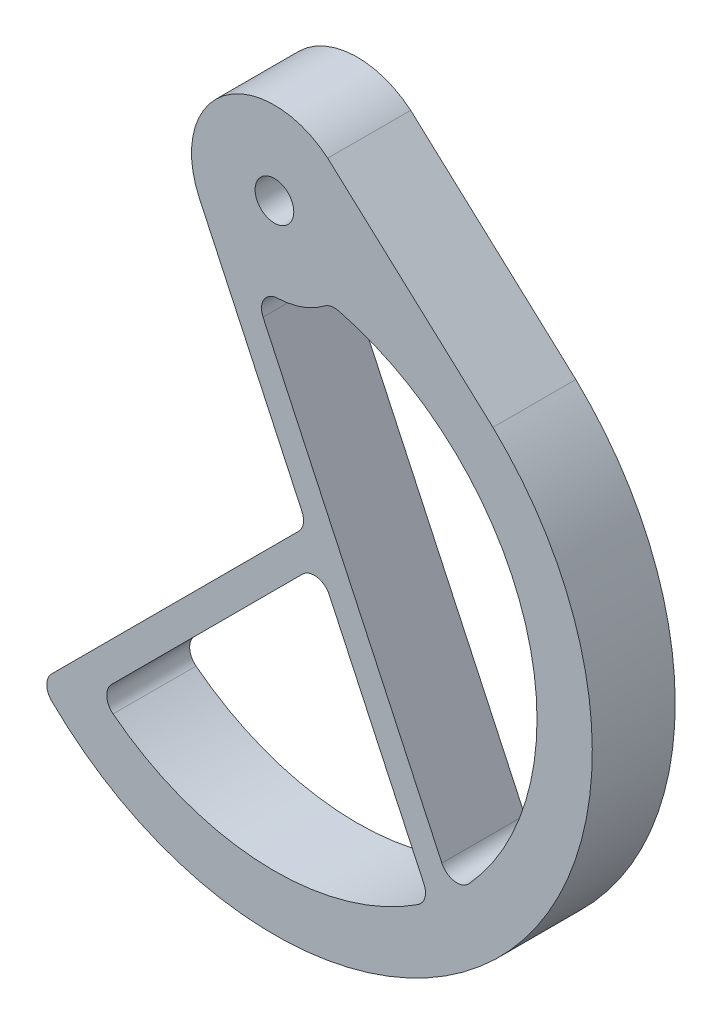
from build123d import *

# Parameters (mm, degrees)
EXTRUDE_1_DEPTH     = 15
SKETCH_6_R          = 3.5
CUT_EXTRUDE_2_DEPTH = 15
SKETCH_8_R          = 10.1
CUT_EXTRUDE_4_DEPTH = 2
SKETCH_9_R          = 0.5
CUT_EXTRUDE_5_DEPTH = 3


with BuildPart() as part:
    # ｽｹｯﾁ1 → ﾎﾞｽ - 押し出し1 (new body)
    with BuildSketch(Plane.XY):
        with BuildLine():
            Line((10.546944731, 68.165925034), (9.641814145, 68.990666647))
            ThreePointArc((9.641814145, 68.990666647), (-9.131421435, 69.400300104), (-13.594616806, 51.160726074))
            Line((-13.594616806, 51.160726074), (4.986432096, 11.313538113))
            ThreePointArc((4.986432096, 11.313538113), (5.221931994, 9.524738795), (4.388829079, 7.924362985))
            Line((4.388829079, 7.924362985), (-40.303464689, -36.767930783))
            ThreePointArc((-40.303464689, -36.767930783), (-41.182112782, -38.903012739), (-40.283913759, -41.029943849))
            ThreePointArc((-40.283913759, -41.029943849), (41.397896806, -39.905690573), (39.524106652, 41.762363359))
            Line((39.524106652, 41.762363359), (37.916838192, 43.226882625))
            Line((37.916838192, 43.226882625), (10.546944731, 68.165925034))
        make_face()
        with BuildLine():
            ThreePointArc((5.093338956, 1.55780505), (7.735603832, 2.390907965), (9.933582661, 0.704339492))
            Line((9.933582661, 0.704339492), (27.046217634, -35.993824637))
            ThreePointArc((27.046217634, -35.993824637), (27.212084573, -38.085077821), (25.967336583, -39.773702754))
            ThreePointArc((25.967336583, -39.773702754), (-1.972837213, -47.459012983), (-29.17877254, -37.481318454))
            ThreePointArc((-29.17877254, -37.481318454), (-30.330146685, -35.299826939), (-29.457223039, -32.992756945))
            Line((-29.457223039, -32.992756945), (5.093338956, 1.55780505))
        make_face(mode=Mode.SUBTRACT)
        with BuildLine():
            ThreePointArc((35.231836325, -31.858557864), (32.560090836, -32.813013733), (30.287744354, -31.114293205))
            Line((30.287744354, -31.114293205), (-2.054746852, 38.244403012))
            ThreePointArc((-2.054746852, 38.244403012), (-1.895310582, 41.077194163), (0.553480425, 42.510214831))
            ThreePointArc((0.553480425, 42.510214831), (5.039223996, 43.371793408), (9.057681155, 45.543478261))
            ThreePointArc((9.057681155, 45.543478261), (10.270904088, 46.091905397), (11.601973614, 46.061309233))
            ThreePointArc((11.601973614, 46.061309233), (45.455779175, 13.784851815), (35.231836325, -31.858557864))
        make_face(mode=Mode.SUBTRACT)
    extrude(amount=EXTRUDE_1_DEPTH)

    # ｽｹｯﾁ6 → ｶｯﾄ - 押し出し2 (cut)
    with BuildSketch(Plane.XY.offset(15)):
        with Locations((0, 57.5)):
            Circle(SKETCH_6_R)
    extrude(amount=-CUT_EXTRUDE_2_DEPTH, mode=Mode.SUBTRACT)

    # ｽｹｯﾁ8 → ｶｯﾄ - 押し出し4 (cut)
    with BuildSketch(Plane(origin=(0, 0, 0), x_dir=(-1, 0, 0), z_dir=(0, 0, -1))):
        with Locations((0, 57.5)):
            Circle(SKETCH_8_R)
    extrude(amount=-CUT_EXTRUDE_4_DEPTH, mode=Mode.SUBTRACT)

    # ｽｹｯﾁ9 → ｶｯﾄ - 押し出し5 (cut)
    with BuildSketch(Plane(origin=(0, 0, 2), x_dir=(-1, 0, 0), z_dir=(0, 0, -1))):
        with Locations((-3.5, 65.5)):
            Circle(SKETCH_9_R)
        with Locations((0, 65.5)):
            Circle(SKETCH_9_R)
        with Locations((3.5, 65.5)):
            Circle(SKETCH_9_R)
        with Locations((8, 57.5)):
            Circle(SKETCH_9_R)
        with Locations((8, 61)):
            Circle(SKETCH_9_R)
        with Locations((8, 54)):
            Circle(SKETCH_9_R)
        with Locations((0, 49.5)):
            Circle(SKETCH_9_R)
        with Locations((3.5, 49.5)):
            Circle(SKETCH_9_R)
        with Locations((-3.5, 49.5)):
            Circle(SKETCH_9_R)
        with Locations((-8, 57.5)):
            Circle(SKETCH_9_R)
        with Locations((-8, 54)):
            Circle(SKETCH_9_R)
        with Locations((-8, 61)):
            Circle(SKETCH_9_R)
    extrude(amount=-CUT_EXTRUDE_5_DEPTH, mode=Mode.SUBTRACT)


solid = part.part
